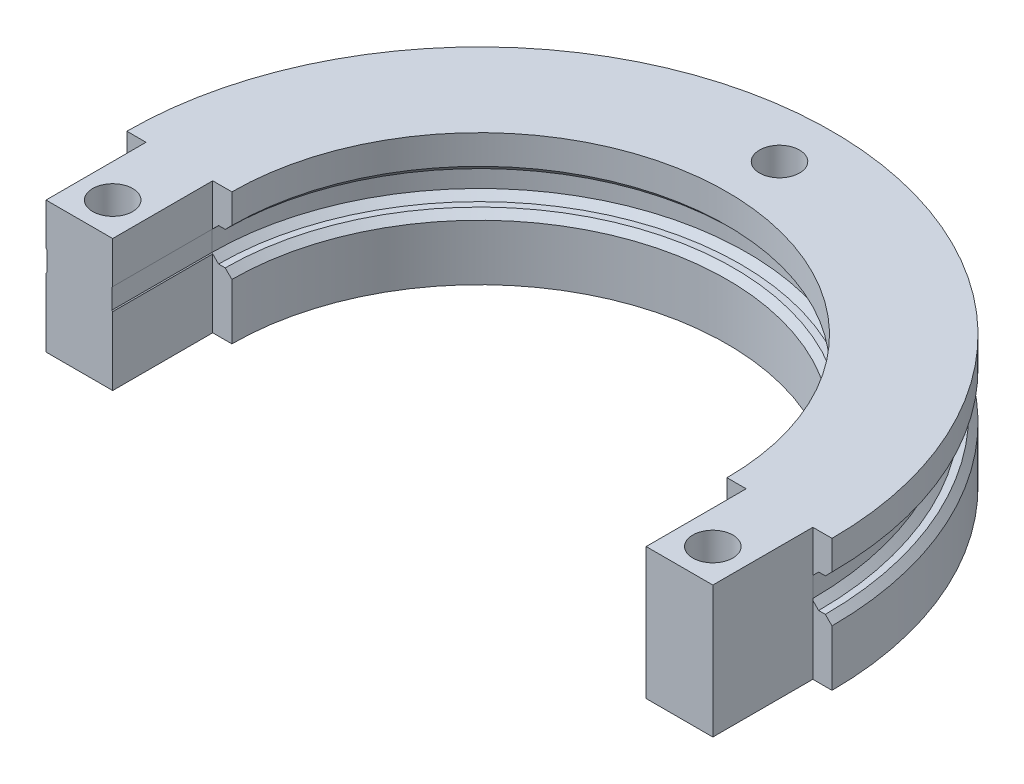
from build123d import *

# Parameters (mm, degrees)
REVOLVE1_ANGLE          = 180
BOSS_EXTRUDE1_DEPTH     = 5.08
BOSS_EXTRUDE2_OUTLINE_W = 12.7
BOSS_EXTRUDE2_OUTLINE_H = 25.08
BOSS_EXTRUDE2_DEPTH     = 19.05
CUT_EXTRUDE2_DEPTH      = 99.22042252
CUT_EXTRUDE2_DEPTH_BACK = 99.22042252
SKETCH5_R               = 2.2225
CUT_EXTRUDE3_DEPTH      = 99.22042252
CUT_EXTRUDE3_DEPTH_BACK = 6.35
SKETCH7_R               = 3.81
BOSS_EXTRUDE3_START     = 1.143
SKETCH5_8_R             = 2.2225
BOSS_EXTRUDE3_DEPTH     = 1.143


# Read off the part's stored shape, not the designer's step: Boss-Extrude2
with BuildPart() as part:
    # Sketch1 → Revolve1 (revolve)
    with BuildSketch(Plane.XY):
        Polygon((-67.15, 10), (-47.15, 10), (-47.15, 4.445), (-48.42, 3.175), (-49.69, 3.175), (-50.96, 1.905), (-50.96, -1.905), (-49.69, -3.175), (-48.42, -3.175), (-47.15, -4.445), (-47.15, -10), (-67.15, -10), (-67.15, -4.445), (-65.88, -3.175), (-64.61, -3.175), (-63.34, -1.905), (-63.34, 1.905), (-64.61, 3.175), (-65.88, 3.175), (-67.15, 4.445), align=None)
    revolve(axis=Axis((0, 0, 0), (0, -1, 0)), revolution_arc=REVOLVE1_ANGLE)

    # Sketch3 → Boss-Extrude1 (add)
    with BuildSketch(Plane.XZ.offset(10)):
        with BuildLine():
            Line((-47.15, 0), (-67.15, 0))
            ThreePointArc((-67.15, 0), (0, -67.15), (67.15, 0))
            Line((67.15, 0), (47.15, 0))
            ThreePointArc((47.15, 0), (0, -47.15), (-47.15, 0))
        make_face()
    extrude(amount=BOSS_EXTRUDE1_DEPTH)

    # Boss-Extrude2 outline → Boss-Extrude2 (add)
    with BuildSketch(Plane.XY):
        Polygon((-50.8, 10), (-63.5, 10), (-63.5, 2.065), (-63.34, 1.905), (-63.34, -1.905), (-63.5, -2.065), (-63.5, -15.08), (-50.8, -15.08), (-50.8, -2.065), (-50.96, -1.905), (-50.96, 1.905), (-50.8, 2.065), align=None)
        with Locations((57.15, -2.54)):
            Rectangle(BOSS_EXTRUDE2_OUTLINE_W, BOSS_EXTRUDE2_OUTLINE_H)
    extrude(amount=BOSS_EXTRUDE2_DEPTH)

    # Sketch5 → Cut-Extrude2 (cut, two sides: drawn at the far end of the back side and taken through both)
    with BuildSketch(Plane.XZ.offset(15.08).offset(-CUT_EXTRUDE2_DEPTH_BACK)):
        with BuildLine():
            ThreePointArc((-54.9275, 12.7), (-55.578455179, 14.271544821), (-57.15, 14.9225))
            Line((-57.15, 14.9225), (-57.15, 10.4775))
            ThreePointArc((-57.15, 10.4775), (-55.578455179, 11.128455179), (-54.9275, 12.7))
        make_face()
        with BuildLine():
            Line((-57.15, 10.4775), (-57.15, 14.9225))
            ThreePointArc((-57.15, 14.9225), (-59.3725, 12.7), (-57.15, 10.4775))
        make_face()
        with Locations(Location((0, -57.15, 0), (0, 0, 270))):
            Circle(SKETCH5_R)
        with Locations(Location((57.15, 12.7, 0), (0, 0, 270))):
            Circle(SKETCH5_R)
    extrude(amount=CUT_EXTRUDE2_DEPTH + CUT_EXTRUDE2_DEPTH_BACK, mode=Mode.SUBTRACT)

    # Sketch7 → Cut-Extrude3 (cut, two sides: drawn at the far end of the back side and taken through both)
    with BuildSketch(Plane(origin=(0, 10, 0), x_dir=(1, 0, 0), z_dir=(0, 1, 0)).offset(-CUT_EXTRUDE3_DEPTH_BACK)):
        with Locations(Location((0, 57.15, 0), (0, 0, 90))):
            Circle(SKETCH7_R)
        with Locations(Location((-57.15, -12.7, 0), (0, 0, 90))):
            Circle(SKETCH7_R)
        with Locations(Location((57.15, -12.7, 0), (0, 0, 90))):
            Circle(SKETCH7_R)
    extrude(amount=CUT_EXTRUDE3_DEPTH + CUT_EXTRUDE3_DEPTH_BACK, mode=Mode.SUBTRACT)

    # Sketch5<8> → Boss-Extrude3 (add)
    # profile 1 of 3: a face of its own
    with BuildSketch(Plane.XZ.offset(15.08).offset(BOSS_EXTRUDE3_START)):
        Polygon((-57.15, 16.54948292), (-60.48375, 14.62474146), (-60.48375, 10.77525854), (-57.15, 8.85051708), (-53.81625, 10.77525854), (-53.81625, 14.62474146), align=None)
        with Locations(Location((-57.15, 12.7, 0), (0, 0, 270))):
            Circle(SKETCH5_8_R, mode=Mode.SUBTRACT)
    # profile 2 of 3: a face of its own
    with BuildSketch(Plane.XZ.offset(15.08).offset(BOSS_EXTRUDE3_START)):
        Polygon((0, -60.99948292), (3.33375, -59.07474146), (3.33375, -55.22525854), (0, -53.30051708), (-3.33375, -55.22525854), (-3.33375, -59.07474146), align=None)
        with Locations(Location((0, -57.15, 0), (0, 0, 270))):
            Circle(SKETCH5_8_R, mode=Mode.SUBTRACT)
    # profile 3 of 3: a face of its own
    with BuildSketch(Plane.XZ.offset(15.08).offset(BOSS_EXTRUDE3_START)):
        Polygon((53.81625, 14.62474146), (57.15, 16.54948292), (60.48375, 14.62474146), (60.48375, 10.77525854), (57.15, 8.85051708), (53.81625, 10.77525854), align=None)
        with Locations(Location((57.15, 12.7, 0), (0, 0, 270))):
            Circle(SKETCH5_8_R, mode=Mode.SUBTRACT)
    extrude(amount=-BOSS_EXTRUDE3_DEPTH)


solid = part.part
